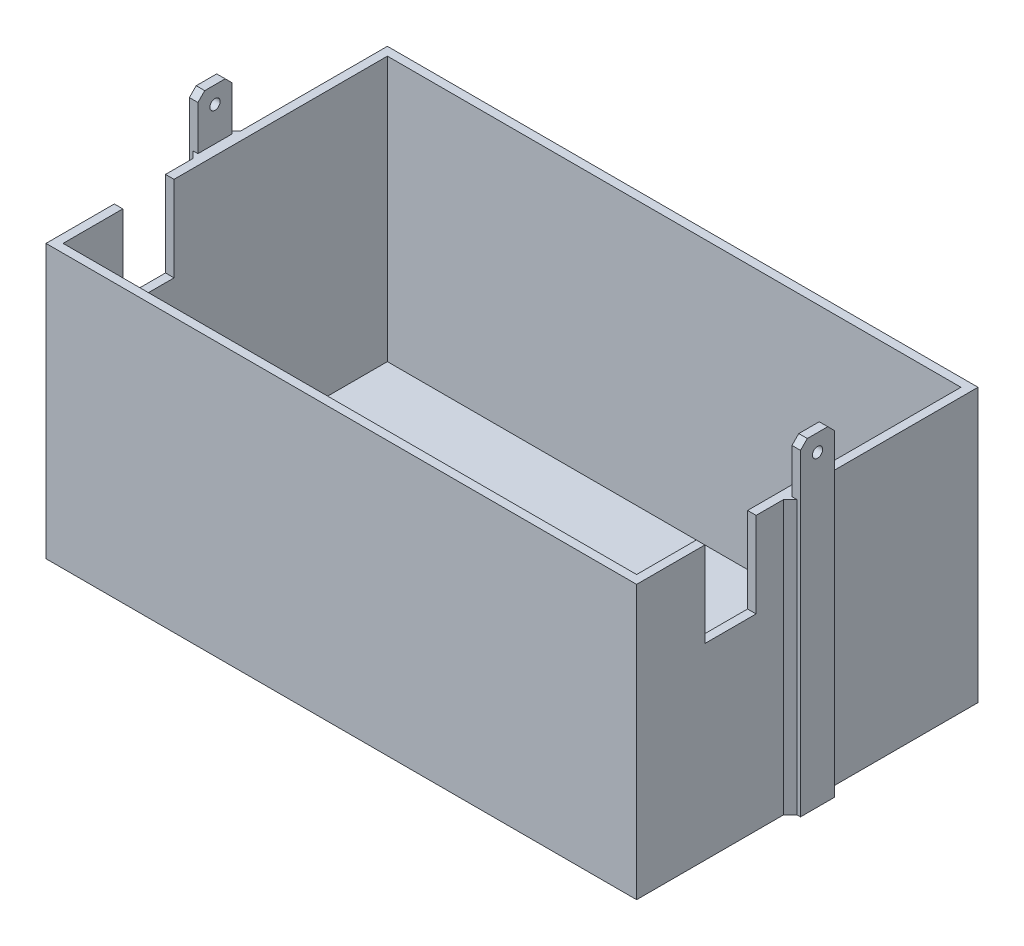
from build123d import *

# Parameters (mm, degrees)
SKETCH1_W           = 173
SKETCH1_H           = 100
BOSS_EXTRUDE1_DEPTH = 80
SHELL2_T            = -2.5
SKETCH3_W           = 3
SKETCH3_H           = 10
BOSS_EXTRUDE2_DEPTH = 95
CHAMFER1_SIZE       = 2
MOVE_FACE1_BY       = 0.5
MOVE_FACE2_BY       = 0.5
SKETCH4_R           = 1.5
CUT_EXTRUDE1_DEPTH  = 209.724699066
CUT_EXTRUDE3_DEPTH  = 2
SKETCH6_W           = 15
SKETCH6_H           = 25
CUT_EXTRUDE4_DEPTH  = 207.157706623


# Read off the part's stored shape, not the designer's step: Cut-Extrude3
with BuildPart() as part:
    # Sketch1 → Boss-Extrude1 (new body)
    with BuildSketch(Plane(origin=(0, 0, 0), x_dir=(1, 0, 0), z_dir=(0, 1, 0))):
        with Locations((4, 0)):
            Rectangle(SKETCH1_W, SKETCH1_H)
    extrude(amount=BOSS_EXTRUDE1_DEPTH)

    # Shell2
    shell2_openings = [part.faces().sort_by_distance(p)[0] for p in [
        (4, 80, 0),
    ]]
    offset(amount=SHELL2_T, openings=shell2_openings, kind=Kind.INTERSECTION)

    # Sketch3 → Boss-Extrude2 (add)
    with BuildSketch(Plane.XZ):
        with Locations((-84, 0)):
            Rectangle(SKETCH3_W, SKETCH3_H)
        with Locations((92, 0)):
            Rectangle(SKETCH3_W, SKETCH3_H)
    extrude(amount=-BOSS_EXTRUDE2_DEPTH)

    # Chamfer1
    chamfer1_edges = [part.edges().sort_by_distance(p)[0] for p in [
        (90.5, 40, 5),
        (90.5, 40, -5),
        (-82.5, 40, -5),
        (-82.5, 40, 5),
        (92, 95, 5),
        (92, 95, -5),
        (-84, 95, -5),
        (-84, 95, 5),
    ]]
    chamfer(chamfer1_edges, length=CHAMFER1_SIZE)

    # Move Face1: a face moved inward by 0.5
    extrude(part.faces().sort_by_distance((-82.5, 87.312785388, 0))[0], amount=MOVE_FACE1_BY, dir=(-1, 0, 0), mode=Mode.SUBTRACT)

    # Move Face2: a face moved inward by 0.5
    extrude(part.faces().sort_by_distance((90.5, 87.312785388, 0))[0], amount=MOVE_FACE2_BY, dir=(1, 0, 0), mode=Mode.SUBTRACT)

    # Sketch4 → Cut-Extrude1 (cut, through all)
    with BuildSketch(Plane.ZY.offset(85.5)):
        with Locations((0, 90)):
            Circle(SKETCH4_R)
    extrude(amount=-CUT_EXTRUDE1_DEPTH, mode=Mode.SUBTRACT)

    # Cut-Extrude3 outline → Cut-Extrude3 (cut)
    with BuildSketch(Plane(origin=(0, 0, 0), x_dir=(1, 0, 0), z_dir=(0, 1, 0))):
        Polygon((80.5, 2.857864376), (80.5, 40), (-72.5, 40), (-72.5, 2.857864376), (-75.357864376, 0), (-72.5, -2.857864376), (-72.5, -40), (80.5, -40), (80.5, -2.857864376), (83.357864376, 0), align=None)
        Polygon((7.417714413, -17.552090263), (12.749188197, -19.378229604), (-23.808346413, 25.027697518), (3.280599797, 4.287723077), (-3.809085344, 7.144760372), (11.640079291, -13.383581677), (12.749188197, -10.769740582), (15.558903364, -13.383581677), (11.640079291, -2.041689211), (19.62402318, -7.712635444), (21.716364262, -22.427069466), (15.060881541, -16.235561356), (14.410666008, -17.767926727), (22.911987737, -28.883436233), align=None, mode=Mode.SUBTRACT)
    extrude(amount=CUT_EXTRUDE3_DEPTH, mode=Mode.SUBTRACT)

    # Sketch6 → Cut-Extrude4 (cut, through all)
    with BuildSketch(Plane.ZY.offset(82.5)):
        with Locations((22.5, 67.5)):
            Rectangle(SKETCH6_W, SKETCH6_H)
    extrude(amount=-CUT_EXTRUDE4_DEPTH, mode=Mode.SUBTRACT)


solid = part.part
